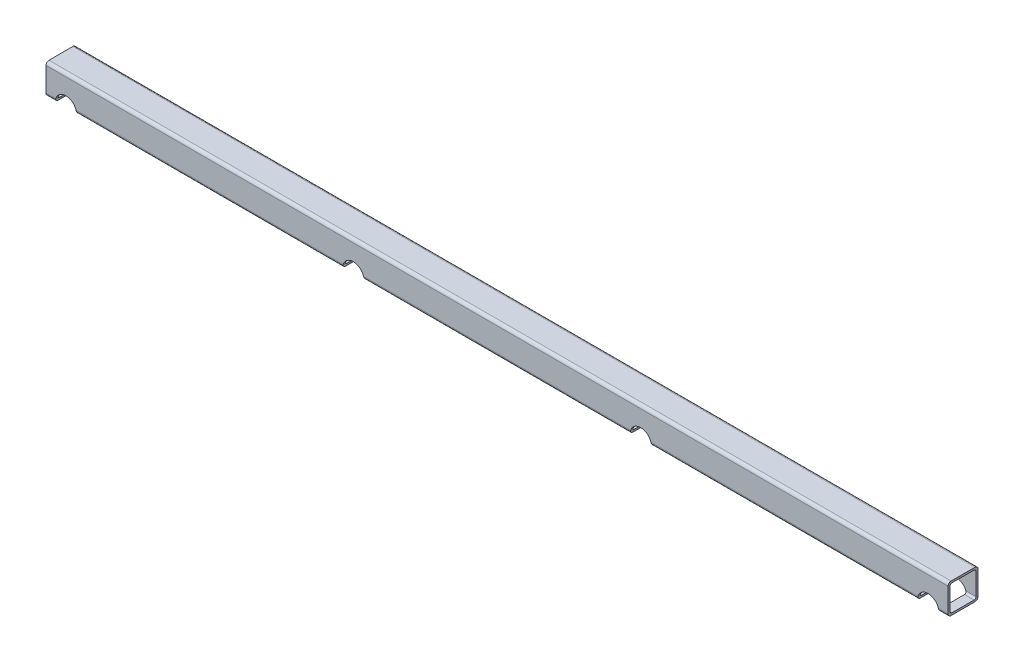
from build123d import *

# Parameters (mm, degrees)
EXTRUDE_1_DEPTH      = 884.980118
EXTRUDE_1_DEPTH_BACK = 20
OTHER_START          = -15
OTHER_1_DEPTH        = 30


# Read off the part's stored shape, not the designer's step: Полость1
with BuildPart() as part:
    # Эскиз1 → Бобышка-Вытянуть1 (new, two sides: drawn at the far end of the back side and taken through both)
    with BuildSketch(Plane(origin=(0, 0, 0), x_dir=(0, 0, -1), z_dir=(1, 0, 0)).offset(-EXTRUDE_1_DEPTH_BACK)):
        with BuildLine():
            Line((-12, 30), (12, 30))
            ThreePointArc((12, 30), (14.121320344, 29.121320344), (15, 27))
            Line((15, 27), (15, 3))
            ThreePointArc((15, 3), (14.121320344, 0.878679656), (12, 0))
            Line((12, 0), (-12, 0))
            ThreePointArc((-12, 0), (-14.121320344, 0.878679656), (-15, 3))
            Line((-15, 3), (-15, 27))
            ThreePointArc((-15, 27), (-14.121320344, 29.121320344), (-12, 30))
        make_face()
        with BuildLine():
            Line((-11, 28), (11, 28))
            ThreePointArc((11, 28), (12.414213562, 27.414213562), (13, 26))
            Line((13, 26), (13, 4))
            ThreePointArc((13, 4), (12.414213562, 2.585786438), (11, 2))
            Line((11, 2), (-11, 2))
            ThreePointArc((-11, 2), (-12.414213562, 2.585786438), (-13, 4))
            Line((-13, 4), (-13, 26))
            ThreePointArc((-13, 26), (-12.414213562, 27.414213562), (-11, 28))
        make_face(mode=Mode.SUBTRACT)
    extrude(amount=EXTRUDE_1_DEPTH + EXTRUDE_1_DEPTH_BACK)

    # Полость1 outline → Полость1 (cut)
    with BuildSketch(Plane.XY.offset(OTHER_START)):
        with BuildLine():
            Line((854.330118087, 0), (875.630118087, 0))
            ThreePointArc((875.630118087, 0), (864.980118087, 10.65), (854.330118087, 0))
        make_face()
        with BuildLine():
            Line((566.003412058, 0), (587.303412058, 0))
            ThreePointArc((587.303412058, 0), (576.653412058, 10.65), (566.003412058, 0))
        make_face()
        with BuildLine():
            Line((277.676706029, 0), (298.976706029, 0))
            ThreePointArc((298.976706029, 0), (288.326706029, 10.65), (277.676706029, 0))
        make_face()
        with BuildLine():
            Line((-10.65, 0), (10.65, 0))
            ThreePointArc((10.65, 0), (0, 10.65), (-10.65, 0))
        make_face()
    extrude(amount=OTHER_1_DEPTH, mode=Mode.SUBTRACT)


solid = part.part
